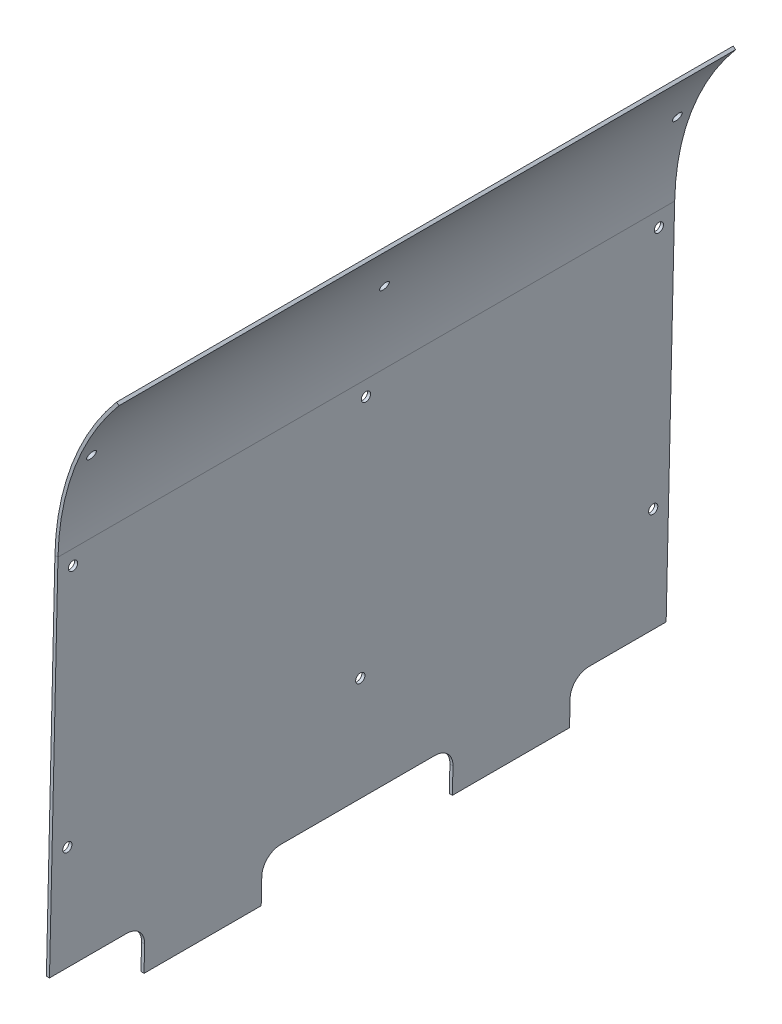
from build123d import *

# Parameters (mm, degrees)
T_LE_DE_BASE_PLI_E1_DEPTH               = 100
ESQUISSE9_R                             = 1.5
ENL_V_MAT_EXTRU_1_DEPTH                 = 1
ESQUISSE6_W                             = 38
ESQUISSE6_H                             = 4
PATTE1_DEPTH                            = 1
DIAM_TRE_DU_PER_AGE_3_0_3_1_D           = 3
DIAM_TRE_DU_PER_AGE_3_0_3_1_ON_FACE_2_D = 3


# Sheet-metal steps are written as plain solids
with BuildPart() as part:
    # Esquisse1 → Tôle de base pliée1 (new, symmetric)
    with BuildSketch(Plane.XY):
        with BuildLine():
            Line((27, 0), (30, 129.962877268))
            ThreePointArc((30, 129.962877268), (35.481668982, 158.18527579), (50, 183))
            Line((50, 183), (50.766044443, 182.35721239))
            ThreePointArc((50.766044443, 182.35721239), (36.417352312, 157.832434881), (30.999733682, 129.939799901))
            Line((30.999733682, 129.939799901), (27.999733682, -0.023077367))
            Line((27.999733682, -0.023077367), (27, 0))
        make_face()
    extrude(amount=T_LE_DE_BASE_PLI_E1_DEPTH, both=True)

    # Esquisse9 → Enlèv. mat.-Extru.1 (cut)
    with BuildSketch(Plane(origin=(27.98535443, -0.646000343, 0), x_dir=(0, 0, -1), z_dir=(0.9997336820980194, -0.02307736724014006, 0))):
        with Locations(Location((-95, 45.620586844, 0), (0, 0, 90))):
            Circle(ESQUISSE9_R)
        with Locations(Location((-95, 125.620586844, 0), (0, 0, 90))):
            Circle(ESQUISSE9_R)
        with Locations(Location((0, 125.620586844, 0), (0, 0, 90))):
            Circle(ESQUISSE9_R)
        with Locations(Location((0, 45.620586844, 0), (0, 0, 90))):
            Circle(ESQUISSE9_R)
        with Locations(Location((95, 45.620586844, 0), (0, 0, 270))):
            Circle(ESQUISSE9_R)
        with Locations(Location((95, 125.620586844, 0), (0, 0, 270))):
            Circle(ESQUISSE9_R)
        with BuildLine():
            Line((-69, 5), (-69, 0.623088915))
            Line((-69, 0.623088915), (-100, 0.623088915))
            Line((-100, 0.623088915), (-100, 11))
            Line((-100, 11), (-75, 11))
            ThreePointArc((-75, 11), (-70.757359313, 9.242640687), (-69, 5))
        make_face()
        with BuildLine():
            Line((25, 11), (-25, 11))
            ThreePointArc((-25, 11), (-29.242640687, 9.242640687), (-31, 5))
            Line((-31, 5), (-31, 0.623088915))
            Line((-31, 0.623088915), (31, 0.623088915))
            Line((31, 0.623088915), (31, 5))
            ThreePointArc((31, 5), (29.242640687, 9.242640687), (25, 11))
        make_face()
        with BuildLine():
            Line((100, 11), (75, 11))
            ThreePointArc((75, 11), (70.757359313, 9.242640687), (69, 5))
            Line((69, 5), (69, 0.623088915))
            Line((69, 0.623088915), (100, 0.623088915))
            Line((100, 0.623088915), (100, 11))
        make_face()
    extrude(amount=-ENL_V_MAT_EXTRU_1_DEPTH, mode=Mode.SUBTRACT)

    # Esquisse6 → Patte1 (add)
    with BuildSketch(Plane(origin=(27.98535443, -0.646000343, 0), x_dir=(0, 0, -1), z_dir=(0.9997336820980194, -0.02307736724014006, 0))):
        with Locations((-50, -1.376911085)):
            Rectangle(ESQUISSE6_W, ESQUISSE6_H)
        with Locations((50, -1.376911085)):
            Rectangle(ESQUISSE6_W, ESQUISSE6_H)
    extrude(amount=-PATTE1_DEPTH)

    # Diamètre du perçage Ø3.0 (3)1 (through all)
    with Locations(Plane(origin=(35.938212122, 159.369298961, -95), x_dir=(-0.366675582569, -0.930348868515, 0), z_dir=(-0.930348868515, 0.366675582569, 0))):
        with Locations((0, 0)):
            Hole(DIAM_TRE_DU_PER_AGE_3_0_3_1_D / 2)

    # Diamètre du perçage Ø3.0 (3)1 on face 2 (through all)
    with Locations(Plane(origin=(35.938212122, 159.369298961, 0), x_dir=(-0.366675899022, -0.930348743793, 0), z_dir=(-0.930348743793, 0.366675899022, 0))):
        with Locations((0, 0), (0, 95)):
            Hole(DIAM_TRE_DU_PER_AGE_3_0_3_1_ON_FACE_2_D / 2)


solid = part.part
